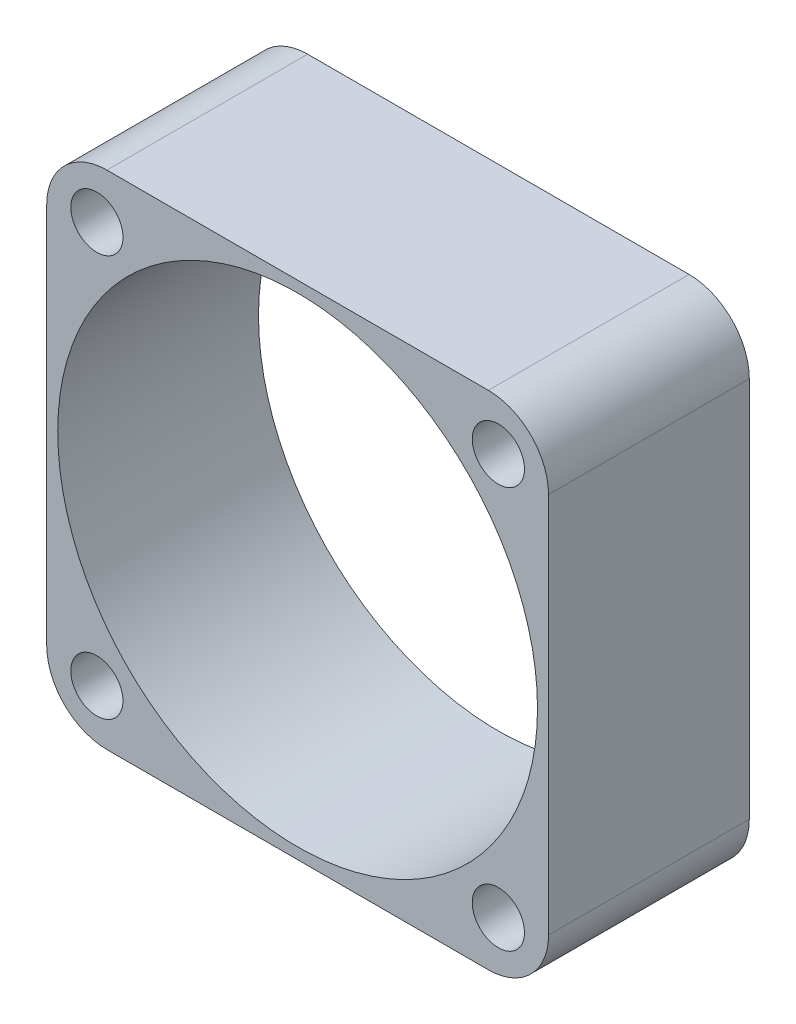
from build123d import *

# Parameters (mm, degrees)
SKETCH1_W           = 25
SKETCH1_H           = 25
BOSS_EXTRUDE1_DEPTH = 10
FILLET1_R           = 3
SKETCH2_R           = 1.3
CUT_EXTRUDE1_DEPTH  = 10
SKETCH3_R           = 11.95
CUT_EXTRUDE2_DEPTH  = 10


with BuildPart() as part:
    # Sketch1 → Boss-Extrude1 (new body)
    with BuildSketch(Plane.XY):
        with Locations((-25.324193791, -75.114139951)):
            Rectangle(SKETCH1_W, SKETCH1_H)
    extrude(amount=BOSS_EXTRUDE1_DEPTH)

    # Fillet1
    fillet1_edges = [part.edges().sort_by_distance(p)[0] for p in [
        (-12.824193791, -87.614139951, 5),
        (-12.824193791, -62.614139951, 5),
        (-37.824193791, -62.614139951, 5),
        (-37.824193791, -87.614139951, 5),
    ]]
    fillet(fillet1_edges, radius=FILLET1_R)

    # Sketch2 → Cut-Extrude1 (cut)
    with BuildSketch(Plane.XY.offset(10)):
        with Locations((-35.324193791, -65.114139951)):
            Circle(SKETCH2_R)
        with Locations((-15.324193791, -65.114139951)):
            Circle(SKETCH2_R)
        with Locations((-15.324193791, -85.114139951)):
            Circle(SKETCH2_R)
        with Locations((-35.324193791, -85.114139951)):
            Circle(SKETCH2_R)
    extrude(amount=-CUT_EXTRUDE1_DEPTH, mode=Mode.SUBTRACT)

    # Sketch3 → Cut-Extrude2 (cut)
    with BuildSketch(Plane.XY.offset(10)):
        with Locations((-25.324193791, -75.114139951)):
            Circle(SKETCH3_R)
    extrude(amount=-CUT_EXTRUDE2_DEPTH, mode=Mode.SUBTRACT)


solid = part.part
